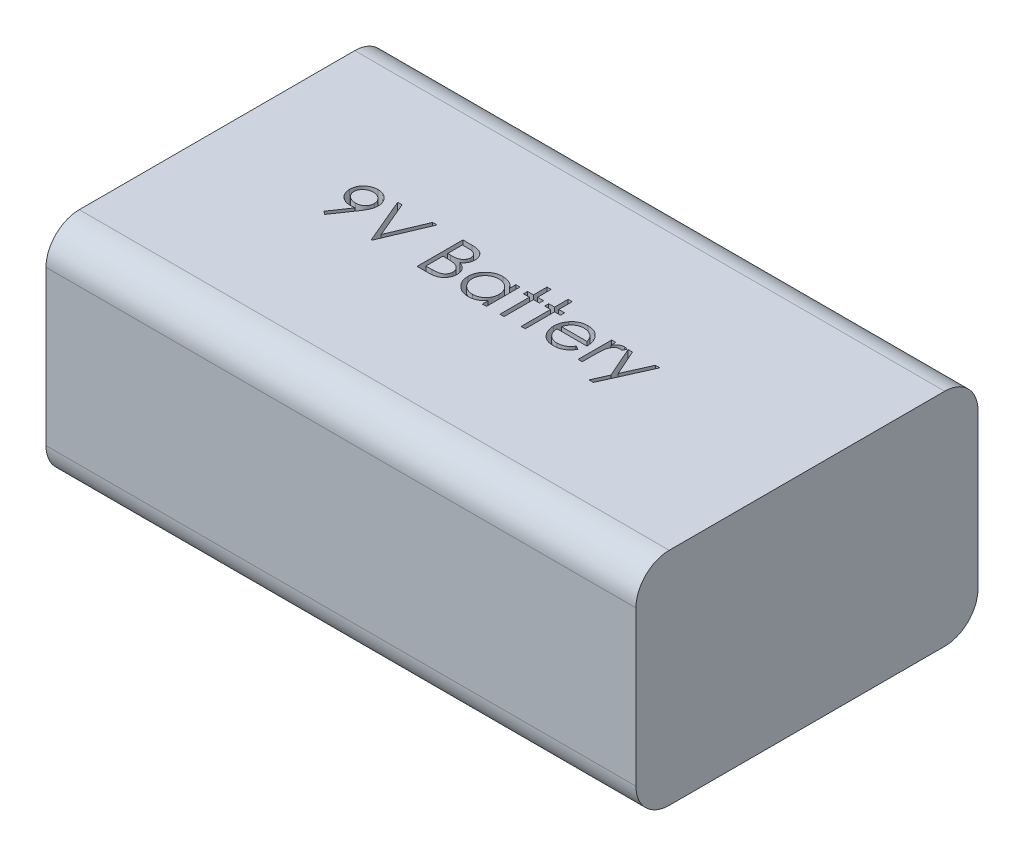
from build123d import *

# Parameters (mm, degrees)
SKETCH1_W           = 47.5742
SKETCH1_H           = 26.1112
BOSS_EXTRUDE1_DEPTH = 16.8656
CUT_EXTRUDE1_DEPTH  = 1.778
SKETCH3_W           = 26.1112
SKETCH3_H           = 16.8656
SKETCH3_R           = 3.81
CUT_EXTRUDE2_DEPTH  = 2.54
FILLET2_R           = 2.54


with BuildPart() as part:
    # Sketch1 → Boss-Extrude1 (new body)
    with BuildSketch(Plane(origin=(0, 0, 0), x_dir=(1, 0, 0), z_dir=(0, 1, 0))):
        with Locations((23.7871, 13.0556)):
            Rectangle(SKETCH1_W, SKETCH1_H)
    extrude(amount=BOSS_EXTRUDE1_DEPTH)

    # Sketch2 → Cut-Extrude1 (cut)
    # profile 1 of 9: a face of its own
    with BuildSketch(Plane(origin=(0, 16.8656, 0), x_dir=(1, 0, 0), z_dir=(0, 1, 0))):
        with BuildLine():
            Line((12.226093924, 11.595445946), (11.975092322, 11.770025272))
            Line((11.975092322, 11.770025272), (12.948249373, 13.192601394))
            add(Edge.make_bspline(
                [(12.948249373, 13.192601394), (12.886158637, 13.185008331), (12.763898517, 13.170057166), (12.640761415, 13.167310511), (12.58016043, 13.165958766)],
                knots=[0, 0, 0, 0, 1.015715272, 2, 2, 2, 2], degree=3))
            add(Edge.make_bspline(
                [(12.58016043, 13.165958766), (12.543418383, 13.166899843), (12.471296956, 13.168747093), (12.365265303, 13.183388902), (12.263379743, 13.205939029), (12.165910387, 13.239587784), (12.072490882, 13.281405993), (11.983325169, 13.333263007), (11.898533278, 13.394269299), (11.819025868, 13.46410229), (11.746714129, 13.540780343), (11.682290831, 13.621935986), (11.6287497, 13.708511956), (11.584273114, 13.798742176), (11.550542661, 13.893923527), (11.525980123, 13.992972927), (11.510857769, 14.096584569), (11.509058673, 14.1671097), (11.508145206, 14.202917901)],
                knots=[0, 0, 0, 0, 1.060718605, 2.082097864, 3.085795603, 4.069760067, 5.054557537, 6.03741023, 7.043284206, 8.066802108, 9.088538119, 10.083643548, 11.053783639, 12.022749082, 12.983451788, 13.964007469, 14.966251758, 16, 16, 16, 16], degree=3))
            add(Edge.make_bspline(
                [(11.508145206, 14.202917901), (11.509879641, 14.251886553), (11.513283985, 14.348002085), (11.540682502, 14.488435854), (11.585742841, 14.621222398), (11.648571218, 14.746012591), (11.727705939, 14.861011331), (11.822814529, 14.96461994), (11.933318494, 15.055364794), (12.056700513, 15.133368871), (12.190053534, 15.196103868), (12.329722192, 15.242343169), (12.474636312, 15.269541917), (12.572803982, 15.273127778), (12.622227738, 15.274933125)],
                knots=[0, 0, 0, 0, 1.022988612, 2.007919123, 2.978103895, 3.94594894, 4.918897164, 5.887013414, 6.875921846, 7.89917871, 8.930658928, 9.948724884, 10.967259574, 12, 12, 12, 12], degree=3))
            add(Edge.make_bspline(
                [(12.622227738, 15.274933125), (12.670716158, 15.273102962), (12.766524705, 15.269486732), (12.907413711, 15.243002763), (13.042354728, 15.19836609), (13.170599715, 15.136681527), (13.289339127, 15.059360619), (13.396114938, 14.967226095), (13.488490477, 14.860220568), (13.566314358, 14.740932078), (13.628784398, 14.612765097), (13.673856681, 14.478981174), (13.70160232, 14.340542453), (13.705098647, 14.246747979), (13.706863155, 14.199412292)],
                knots=[0, 0, 0, 0, 1.026385292, 2.028040595, 3.023318987, 4.028184125, 5.03290303, 6.015178782, 7.004435299, 8.016004309, 9.023023918, 10.015172535, 10.998308025, 12, 12, 12, 12], degree=3))
            add(Edge.make_bspline(
                [(13.706863155, 14.199412292), (13.705684746, 14.162668525), (13.703294638, 14.088142984), (13.686558331, 13.974912641), (13.658138146, 13.859461412), (13.625886447, 13.761739816), (13.594754279, 13.681031366), (13.565453148, 13.617279786), (13.532940994, 13.550178523), (13.495022229, 13.480431185), (13.454259932, 13.40714865), (13.408200656, 13.331065934), (13.357895084, 13.252080941), (13.322065364, 13.198833853), (13.303718123, 13.17156774)],
                knots=[0, 0, 0, 0, 1.179839688, 2.393009684, 3.667231171, 4.993948276, 5.694988576, 6.444077775, 7.246288328, 8.089075292, 8.993003841, 9.939041771, 10.944649915, 12, 12, 12, 12], degree=3))
            Line((13.303718123, 13.17156774), (12.226093924, 11.595445946))
        make_face()
        with BuildLine():
            add(Edge.make_bspline(
                [(12.638353539, 13.524933125), (12.666187554, 13.525693509), (12.720370917, 13.527173717), (12.799748216, 13.536182959), (12.874672419, 13.552156945), (12.945343668, 13.575076658), (13.01247057, 13.602733326), (13.074986899, 13.637945313), (13.132944974, 13.679961947), (13.186732901, 13.727171963), (13.234496901, 13.779622547), (13.277039931, 13.834519653), (13.313200499, 13.892104263), (13.341763776, 13.953097526), (13.365248351, 14.016014734), (13.381466363, 14.081869089), (13.390450697, 14.15031749), (13.391982271, 14.196816148), (13.392760591, 14.220445946)],
                knots=[0, 0, 0, 0, 1.163407946, 2.26475976, 3.333800367, 4.359385343, 5.366239384, 6.363380779, 7.350133999, 8.353570782, 9.349036268, 10.310270964, 11.253520213, 12.184142, 13.120487599, 14.056272588, 15.012232024, 16, 16, 16, 16], degree=3))
            add(Edge.make_bspline(
                [(13.392760591, 14.220445946), (13.392090922, 14.244085611), (13.390771256, 14.290670471), (13.380183957, 14.359220211), (13.361558733, 14.424913471), (13.336568249, 14.488109901), (13.303648011, 14.548290273), (13.264144525, 14.606210145), (13.217212075, 14.661502273), (13.163209509, 14.712866256), (13.104974956, 14.760214156), (13.042914456, 14.802000232), (12.97753954, 14.837021428), (12.90924905, 14.865920398), (12.837900701, 14.888472174), (12.763536713, 14.904689538), (12.685781308, 14.913661293), (12.633000021, 14.915183187), (12.606101937, 14.915958766)],
                knots=[0, 0, 0, 0, 0.972161553, 1.915763587, 2.844109794, 3.775983486, 4.705125789, 5.659731448, 6.655561913, 7.682237399, 8.721216875, 9.739758359, 10.754845918, 11.767244016, 12.7857855, 13.828538656, 14.893392813, 16, 16, 16, 16], degree=3))
            add(Edge.make_bspline(
                [(12.606101937, 14.915958766), (12.579437784, 14.915181934), (12.527122934, 14.913657797), (12.450058775, 14.904706592), (12.376197607, 14.888363108), (12.305055987, 14.865930844), (12.236767526, 14.837019272), (12.171395693, 14.801998397), (12.109320677, 14.760223774), (12.051141956, 14.712829002), (11.997044034, 14.661741356), (11.950918505, 14.605967927), (11.911324613, 14.548320402), (11.87844961, 14.488101894), (11.853447093, 14.424915609), (11.834825091, 14.359219632), (11.824236926, 14.290670622), (11.822917379, 14.244085662), (11.82224777, 14.220445946)],
                knots=[0, 0, 0, 0, 1.099389452, 2.15699305, 3.192601482, 4.213358962, 5.227959689, 6.245255729, 7.266013209, 8.307253147, 9.336162325, 10.327954924, 11.284637477, 12.215801273, 13.149702402, 14.080068371, 15.025723358, 16, 16, 16, 16], degree=3))
            add(Edge.make_bspline(
                [(11.82224777, 14.220445946), (11.822853696, 14.196797747), (11.824048694, 14.150159171), (11.835576483, 14.081632778), (11.854854763, 14.015944584), (11.880674154, 13.952455877), (11.914675744, 13.891784019), (11.956399592, 13.834216657), (12.005305138, 13.779101207), (12.060738626, 13.727293995), (12.121406786, 13.679741819), (12.186203533, 13.638211437), (12.254013369, 13.603138993), (12.325075, 13.574997609), (12.3988618, 13.552385945), (12.476036932, 13.5362124), (12.556345169, 13.527260133), (12.610755151, 13.525716236), (12.638353539, 13.524933125)],
                knots=[0, 0, 0, 0, 0.952633368, 1.87876736, 2.791047057, 3.707742249, 4.635551637, 5.587206343, 6.568248508, 7.601284464, 8.641511608, 9.671105535, 10.699146789, 11.713763218, 12.747829548, 13.806491675, 14.887386225, 16, 16, 16, 16], degree=3))
        make_face(mode=Mode.SUBTRACT)
    # profile 2 of 9: a face of its own
    with BuildSketch(Plane(origin=(0, 16.8656, 0), x_dir=(1, 0, 0), z_dir=(0, 1, 0))):
        Polygon((14.200452898, 15.185189535), (14.53699136, 15.185189535), (15.703658027, 12.426976394), (16.870324693, 15.185189535), (17.206863155, 15.185189535), (15.726093924, 11.685189535), (15.681222129, 11.685189535), align=None)
    # profile 3 of 9: a face of its own
    with BuildSketch(Plane(origin=(0, 16.8656, 0), x_dir=(1, 0, 0), z_dir=(0, 1, 0))):
        with BuildLine():
            Line((19.181222129, 15.185189535), (19.864114757, 15.185189535))
            add(Edge.make_bspline(
                [(19.864114757, 15.185189535), (19.897543236, 15.185013785), (19.962335946, 15.184673137), (20.056555388, 15.179390006), (20.144804198, 15.172186336), (20.227107971, 15.160756243), (20.303428673, 15.146964466), (20.37399631, 15.13026265), (20.438586483, 15.110236036), (20.515699219, 15.078389755), (20.60361988, 15.031066587), (20.698818273, 14.961138022), (20.780222512, 14.875605558), (20.850408829, 14.779122903), (20.906209949, 14.672987131), (20.946579246, 14.559727942), (20.972137122, 14.440806201), (20.974765556, 14.359163023), (20.976093924, 14.317901875)],
                knots=[0, 0, 0, 0, 1.001505555, 1.941167018, 2.826882275, 3.653841531, 4.429895133, 5.150066043, 5.825578002, 6.45369114, 7.647487171, 8.808567382, 9.977351308, 11.170798116, 12.373658725, 13.556498008, 14.765093433, 16, 16, 16, 16], degree=3))
            add(Edge.make_bspline(
                [(20.976093924, 14.317901875), (20.975000706, 14.279249319), (20.972852428, 14.203293402), (20.952309669, 14.092199293), (20.920149001, 13.986448074), (20.875443751, 13.886425689), (20.817341755, 13.794392076), (20.748483437, 13.70960481), (20.665406634, 13.635653753), (20.603163394, 13.59431085), (20.571546648, 13.573310529)],
                knots=[0, 0, 0, 0, 1.044552857, 2.05264487, 3.044412934, 4.028983338, 5.005914585, 5.980388656, 6.974128949, 8, 8, 8, 8], degree=3))
            add(Edge.make_bspline(
                [(20.571546648, 13.573310529), (20.611307076, 13.55804553), (20.687378623, 13.528839806), (20.792064636, 13.477204342), (20.882259481, 13.421042231), (20.958656627, 13.359710381), (21.023994282, 13.29360157), (21.081047223, 13.221746456), (21.129728597, 13.143207698), (21.171441521, 13.058804163), (21.203990277, 12.969397694), (21.228366181, 12.875826918), (21.242333631, 12.778427363), (21.244321272, 12.712141984), (21.245324693, 12.678679119)],
                knots=[0, 0, 0, 0, 1.27268992, 2.434971085, 3.483601985, 4.442670788, 5.356604649, 6.2567628, 7.179492994, 8.113709626, 9.066344395, 10.018646069, 10.999752585, 12, 12, 12, 12], degree=3))
            add(Edge.make_bspline(
                [(21.245324693, 12.678679119), (21.244347847, 12.644512246), (21.242425875, 12.577287968), (21.228245904, 12.478532834), (21.204236797, 12.384157887), (21.17116565, 12.293552705), (21.128003336, 12.20689257), (21.075475371, 12.124079306), (21.012843808, 12.045944975), (20.942780939, 11.971621352), (20.863518793, 11.904793565), (20.778003038, 11.845277858), (20.685156718, 11.796331796), (20.586504724, 11.755215775), (20.480940408, 11.723808576), (20.368937801, 11.701836002), (20.250593499, 11.687030965), (20.169383748, 11.68581376), (20.127736552, 11.685189535)],
                knots=[0, 0, 0, 0, 0.978564426, 1.925352924, 2.850884081, 3.763762016, 4.682927383, 5.618979971, 6.567305752, 7.547517671, 8.540179244, 9.531824382, 10.526200242, 11.540722885, 12.589160233, 13.674978461, 14.80764778, 16, 16, 16, 16], degree=3))
            Line((20.127736552, 11.685189535), (19.181222129, 11.685189535))
            Line((19.181222129, 11.685189535), (19.181222129, 15.185189535))
        make_face()
        with BuildLine():
            Line((19.495324693, 14.826215176), (19.495324693, 13.704420305))
            Line((19.495324693, 13.704420305), (19.706362354, 13.704420305))
            add(Edge.make_bspline(
                [(19.706362354, 13.704420305), (19.737211149, 13.704820228), (19.796817308, 13.70559296), (19.883137205, 13.707806477), (19.963262223, 13.714004521), (20.037054056, 13.720200783), (20.1043965, 13.73027537), (20.165140361, 13.742267493), (20.220238958, 13.754950398), (20.283778504, 13.776519885), (20.355851452, 13.808397561), (20.432684557, 13.857869397), (20.500419026, 13.91679375), (20.557616214, 13.984784712), (20.604427684, 14.059650897), (20.6369414, 14.140197778), (20.658988684, 14.22441791), (20.660980215, 14.282236163), (20.66199136, 14.311591779)],
                knots=[0, 0, 0, 0, 1.156816544, 2.235205308, 3.236616184, 4.169592532, 5.011045266, 5.787822928, 6.49130361, 7.128639758, 8.301311294, 9.436451833, 10.541879658, 11.654887649, 12.756523258, 13.837046038, 14.901820046, 16, 16, 16, 16], degree=3))
            add(Edge.make_bspline(
                [(20.66199136, 14.311591779), (20.66146518, 14.33101755), (20.66043302, 14.369123322), (20.651979717, 14.424672677), (20.637612143, 14.476916429), (20.61915785, 14.526570539), (20.593369161, 14.57208239), (20.563005698, 14.615025585), (20.526320007, 14.653937704), (20.484562695, 14.690307202), (20.436554072, 14.72255173), (20.38232278, 14.750792493), (20.321135103, 14.77353327), (20.254022248, 14.793449422), (20.17995116, 14.807437716), (20.099776607, 14.819091104), (20.012841888, 14.825023846), (19.952696785, 14.825809209), (19.921606745, 14.826215176)],
                knots=[0, 0, 0, 0, 0.91205012, 1.789085906, 2.630437955, 3.453916878, 4.269457761, 5.079663411, 5.91843418, 6.774407191, 7.675494373, 8.627863946, 9.638891023, 10.736472738, 11.911756761, 13.175263542, 14.539845004, 16, 16, 16, 16], degree=3))
            Line((19.921606745, 14.826215176), (19.495324693, 14.826215176))
        make_face(mode=Mode.SUBTRACT)
        with BuildLine():
            Line((19.495324693, 13.345445946), (19.495324693, 12.044163894))
            Line((19.495324693, 12.044163894), (19.942640398, 12.044163894))
            add(Edge.make_bspline(
                [(19.942640398, 12.044163894), (19.974659324, 12.044547642), (20.036371583, 12.045287264), (20.125472813, 12.047701819), (20.208055917, 12.053194094), (20.283744053, 12.061839944), (20.353354505, 12.071218393), (20.416052208, 12.083829674), (20.472345402, 12.098278635), (20.537619709, 12.120612807), (20.611123218, 12.155309278), (20.690334074, 12.207623504), (20.760760292, 12.269946812), (20.820565551, 12.342077726), (20.86957854, 12.420509053), (20.905233995, 12.503654403), (20.927224852, 12.590139931), (20.929887021, 12.649106643), (20.931222129, 12.678679119)],
                knots=[0, 0, 0, 0, 1.160039823, 2.235823828, 3.228722157, 4.157150951, 4.99529583, 5.772374946, 6.472645482, 7.099169577, 8.269452708, 9.405989375, 10.527446681, 11.663510218, 12.788923519, 13.866172445, 14.929861265, 16, 16, 16, 16], degree=3))
            add(Edge.make_bspline(
                [(20.931222129, 12.678679119), (20.930946025, 12.697172459), (20.93039827, 12.733860841), (20.922137655, 12.78777666), (20.910123785, 12.840002533), (20.894592351, 12.890680274), (20.871972884, 12.93889365), (20.845566339, 12.98559621), (20.814604937, 13.030849689), (20.766360772, 13.088061943), (20.696188787, 13.153978956), (20.596482012, 13.218516458), (20.483109714, 13.270564265), (20.400882221, 13.292663741), (20.358405623, 13.30407976)],
                knots=[0, 0, 0, 0, 0.723448775, 1.435228256, 2.130040452, 2.821711965, 3.505591119, 4.210454504, 4.921174351, 5.648778258, 7.137944449, 8.670945889, 10.280296675, 12, 12, 12, 12], degree=3))
            add(Edge.make_bspline(
                [(20.358405623, 13.30407976), (20.341376527, 13.307534844), (20.304453935, 13.315026178), (20.244246354, 13.322933882), (20.175510485, 13.329978942), (20.098087608, 13.335190099), (20.011879767, 13.340576643), (19.916702848, 13.342671464), (19.812945534, 13.345170724), (19.740953161, 13.345351858), (19.703557866, 13.345445946)],
                knots=[0, 0, 0, 0, 0.634451884, 1.375622551, 2.216452059, 3.157844607, 4.20941857, 5.370758133, 6.634282058, 8, 8, 8, 8], degree=3))
            Line((19.703557866, 13.345445946), (19.495324693, 13.345445946))
        make_face(mode=Mode.SUBTRACT)
    # profile 4 of 9: a face of its own
    with BuildSketch(Plane(origin=(0, 16.8656, 0), x_dir=(1, 0, 0), z_dir=(0, 1, 0))):
        with BuildLine():
            Line((24.476093924, 14.242881843), (24.476093924, 11.685189535))
            Line((24.476093924, 11.685189535), (24.16199136, 11.685189535))
            Line((24.16199136, 11.685189535), (24.16199136, 12.127597388))
            add(Edge.make_bspline(
                [(24.16199136, 12.127597388), (24.126572569, 12.087557794), (24.057452354, 12.009420023), (23.942011236, 11.90733785), (23.819643058, 11.822959529), (23.690941737, 11.754809613), (23.556023494, 11.703617557), (23.415187406, 11.667231398), (23.268376026, 11.643837562), (23.168123671, 11.641501541), (23.117319886, 11.64031774)],
                knots=[0, 0, 0, 0, 1.074387032, 2.096679803, 3.090159297, 4.057316773, 5.018401886, 5.985159533, 6.978961417, 8, 8, 8, 8], degree=3))
            add(Edge.make_bspline(
                [(23.117319886, 11.64031774), (23.072151932, 11.641544113), (22.983078727, 11.643962573), (22.85204965, 11.662724877), (22.7259574, 11.692855498), (22.604682828, 11.734756388), (22.489010682, 11.790337209), (22.377950586, 11.856878458), (22.272077894, 11.936119288), (22.173006355, 12.026707316), (22.081774354, 12.125102303), (22.001713082, 12.23004785), (21.934960002, 12.341090154), (21.879139921, 12.456823308), (21.836143577, 12.578138227), (21.806169942, 12.704615395), (21.787429496, 12.836105269), (21.785012035, 12.925644792), (21.783786232, 12.971046907)],
                knots=[0, 0, 0, 0, 1.033919861, 2.038935746, 3.024066025, 3.998881131, 4.97069526, 5.957263378, 6.95902576, 7.993208707, 9.027059324, 10.027763471, 11.009749337, 11.988697705, 12.965288445, 13.950418724, 14.960734635, 16, 16, 16, 16], degree=3))
            add(Edge.make_bspline(
                [(21.783786232, 12.971046907), (21.785039203, 13.015510611), (21.78751626, 13.103412954), (21.80596948, 13.232691652), (21.837000488, 13.357209913), (21.880548336, 13.476566856), (21.936390291, 13.590906906), (22.004318378, 13.700310931), (22.084337503, 13.805080329), (22.17658991, 13.902751555), (22.27652468, 13.99297217), (22.383433411, 14.071381215), (22.494656692, 14.139098064), (22.611919703, 14.19275154), (22.733486808, 14.236160645), (22.860440253, 14.266193613), (22.992251832, 14.283890934), (23.081742324, 14.286453698), (23.127135591, 14.287753638)],
                knots=[0, 0, 0, 0, 1.020392517, 2.01726096, 2.990465484, 3.961182959, 4.928053699, 5.906110375, 6.912531644, 7.948652711, 8.985773172, 9.998621852, 10.987621588, 11.969261332, 12.953316658, 13.946091881, 14.958173133, 16, 16, 16, 16], degree=3))
            add(Edge.make_bspline(
                [(23.127135591, 14.287753638), (23.17933545, 14.286315886), (23.28169691, 14.283496523), (23.431424919, 14.260033796), (23.573069397, 14.220395329), (23.707723749, 14.166477831), (23.834904435, 14.094829102), (23.953407419, 14.004449141), (24.064472903, 13.895907954), (24.128853194, 13.812537509), (24.16199136, 13.769624631)],
                knots=[0, 0, 0, 0, 1.038897134, 2.037228247, 3.008116434, 3.962042015, 4.918381754, 5.904844433, 6.921570401, 8, 8, 8, 8], degree=3))
            Line((24.16199136, 13.769624631), (24.16199136, 14.242881843))
            Line((24.16199136, 14.242881843), (24.476093924, 14.242881843))
        make_face()
        with BuildLine():
            add(Edge.make_bspline(
                [(23.131342322, 13.973651074), (23.085427984, 13.972017436), (22.994800384, 13.968792895), (22.861756382, 13.9436194), (22.734442968, 13.901734805), (22.613496893, 13.844452904), (22.500828677, 13.772424168), (22.400135006, 13.685302784), (22.310592304, 13.58546577), (22.23528404, 13.47336366), (22.173893543, 13.353185569), (22.130726511, 13.227561131), (22.102257264, 13.098756153), (22.099348743, 13.011393467), (22.097888796, 12.967541298)],
                knots=[0, 0, 0, 0, 1.031046209, 2.035121221, 3.029706178, 4.034933723, 5.034054252, 6.02443088, 7.017295772, 8.038157696, 9.050218397, 10.03989886, 11.016116709, 12, 12, 12, 12], degree=3))
            add(Edge.make_bspline(
                [(22.097888796, 12.967541298), (22.099753689, 12.923951191), (22.103476166, 12.836941835), (22.13022686, 12.707961258), (22.175106734, 12.582307216), (22.236348797, 12.461046223), (22.313035421, 12.348462122), (22.401924074, 12.246722), (22.503874355, 12.159232412), (22.616801862, 12.085994838), (22.737409833, 12.026832317), (22.864243764, 11.985666677), (22.994919402, 11.959088897), (23.083771736, 11.95598442), (23.128537834, 11.954420305)],
                knots=[0, 0, 0, 0, 0.979072187, 1.954306742, 2.945804271, 3.96968567, 4.997920485, 5.998718438, 6.996577872, 8.005894225, 9.015743152, 10.005417472, 10.995077863, 12, 12, 12, 12], degree=3))
            add(Edge.make_bspline(
                [(23.128537834, 11.954420305), (23.173984337, 11.956080268), (23.264372924, 11.959381772), (23.397811632, 11.984663037), (23.527306594, 12.026431836), (23.651093823, 12.084330962), (23.766409954, 12.156088318), (23.869907831, 12.240095409), (23.9574238, 12.337798593), (24.031616409, 12.445175047), (24.089791826, 12.562887043), (24.132167885, 12.688221234), (24.157221791, 12.821181982), (24.160379521, 12.912045909), (24.16199136, 12.958426715)],
                knots=[0, 0, 0, 0, 1.01762866, 2.023962475, 3.030623092, 4.058876274, 5.077231937, 6.066672613, 7.034107872, 8.005628644, 8.981990164, 9.965428785, 10.961468474, 12, 12, 12, 12], degree=3))
            add(Edge.make_bspline(
                [(24.16199136, 12.958426715), (24.161031704, 12.993764545), (24.159142796, 13.063320579), (24.144712227, 13.165448096), (24.1217573, 13.263181822), (24.08941113, 13.356624511), (24.046919846, 13.445259527), (23.99567208, 13.529723287), (23.93476663, 13.609576498), (23.865183934, 13.683719569), (23.789018732, 13.751346032), (23.708424191, 13.811710272), (23.622445444, 13.861299045), (23.532528407, 13.902340316), (23.438517073, 13.934999466), (23.339646453, 13.95678716), (23.236967466, 13.971747481), (23.16692141, 13.973009862), (23.131342322, 13.973651074)],
                knots=[0, 0, 0, 0, 1.050140795, 2.067009409, 3.05949893, 4.030605086, 5.00011959, 5.97591094, 6.962425594, 7.979863591, 8.993523472, 9.986985069, 10.967611495, 11.937549037, 12.921786183, 13.919465291, 14.943216303, 16, 16, 16, 16], degree=3))
        make_face(mode=Mode.SUBTRACT)
    # profile 5 of 9: a face of its own
    with BuildSketch(Plane(origin=(0, 16.8656, 0), x_dir=(1, 0, 0), z_dir=(0, 1, 0))):
        Polygon((25.508145206, 15.274933125), (25.82224777, 15.274933125), (25.82224777, 14.242881843), (26.270965719, 14.242881843), (26.270965719, 13.928779279), (25.82224777, 13.928779279), (25.82224777, 11.685189535), (25.508145206, 11.685189535), (25.508145206, 13.928779279), (25.059427257, 13.928779279), (25.059427257, 14.242881843), (25.508145206, 14.242881843), align=None)
    # profile 6 of 9: a face of its own
    with BuildSketch(Plane(origin=(0, 16.8656, 0), x_dir=(1, 0, 0), z_dir=(0, 1, 0))):
        Polygon((27.123529822, 15.274933125), (27.437632386, 15.274933125), (27.437632386, 14.242881843), (27.886350334, 14.242881843), (27.886350334, 13.928779279), (27.437632386, 13.928779279), (27.437632386, 11.685189535), (27.123529822, 11.685189535), (27.123529822, 13.928779279), (26.674811873, 13.928779279), (26.674811873, 14.242881843), (27.123529822, 14.242881843), align=None)
    # profile 7 of 9: a face of its own
    with BuildSketch(Plane(origin=(0, 16.8656, 0), x_dir=(1, 0, 0), z_dir=(0, 1, 0))):
        with BuildLine():
            Line((30.523970527, 12.492881843), (30.803017001, 12.346347388))
            add(Edge.make_bspline(
                [(30.803017001, 12.346347388), (30.780780406, 12.306904057), (30.737516797, 12.230162954), (30.663116049, 12.124731093), (30.585123977, 12.029883377), (30.500020009, 11.948153723), (30.41035033, 11.876902338), (30.315617675, 11.814564513), (30.215328857, 11.761445993), (30.109479133, 11.716693465), (29.997179581, 11.682283971), (29.878158065, 11.65797975), (29.75218657, 11.642956482), (29.66584039, 11.641211341), (29.621626777, 11.64031774)],
                knots=[0, 0, 0, 0, 1.120438281, 2.179929193, 3.190490725, 4.156257408, 5.095198341, 6.022838206, 6.959905092, 7.901321166, 8.864066838, 9.862729781, 10.905609505, 12, 12, 12, 12], degree=3))
            add(Edge.make_bspline(
                [(29.621626777, 11.64031774), (29.572484799, 11.641464916), (29.476623037, 11.643702722), (29.33708329, 11.662995187), (29.205703872, 11.694467546), (29.082492169, 11.738433087), (28.967749916, 11.795860411), (28.861249061, 11.865819893), (28.762429535, 11.947952148), (28.674405326, 12.042968591), (28.595161443, 12.144650548), (28.525235623, 12.250606433), (28.466778192, 12.360569657), (28.419225582, 12.473840181), (28.380820717, 12.589704075), (28.354054013, 12.709215543), (28.338624265, 12.832051127), (28.33625982, 12.915148463), (28.335068283, 12.957024471)],
                knots=[0, 0, 0, 0, 1.145258523, 2.234067595, 3.276747158, 4.290159414, 5.277019952, 6.260822364, 7.254936242, 8.264827045, 9.274100331, 10.257902744, 11.220704747, 12.172965371, 13.118907548, 14.062713208, 15.023725156, 16, 16, 16, 16], degree=3))
            add(Edge.make_bspline(
                [(28.335068283, 12.957024471), (28.336127424, 12.996319302), (28.338226503, 13.074196466), (28.35145729, 13.189462011), (28.374905583, 13.301490463), (28.407081907, 13.410374911), (28.448633153, 13.515933045), (28.499465372, 13.618229109), (28.55965775, 13.717154249), (28.606130424, 13.779557382), (28.629539437, 13.810990817)],
                knots=[0, 0, 0, 0, 1.024358464, 2.0301432, 3.019427413, 4.004406732, 4.986367066, 5.972626655, 6.978780325, 8, 8, 8, 8], degree=3))
            add(Edge.make_bspline(
                [(28.629539437, 13.810990817), (28.66124712, 13.848859687), (28.723658066, 13.923397838), (28.829214422, 14.021336164), (28.943514618, 14.103379939), (29.065126244, 14.171387075), (29.195462718, 14.223060722), (29.332772009, 14.261568304), (29.478617595, 14.283146315), (29.578322816, 14.286194149), (29.629339116, 14.287753638)],
                knots=[0, 0, 0, 0, 1.030682036, 2.02871468, 2.997146059, 3.962720338, 4.930598197, 5.918074684, 6.934738563, 8, 8, 8, 8], degree=3))
            add(Edge.make_bspline(
                [(29.629339116, 14.287753638), (29.681786722, 14.286399589), (29.784676968, 14.283743254), (29.934709089, 14.25911692), (30.076669805, 14.220064366), (30.21050231, 14.164910575), (30.33622017, 14.093751023), (30.45300622, 14.005609182), (30.562857732, 13.903191095), (30.626766311, 13.824427885), (30.659287033, 13.784348189)],
                knots=[0, 0, 0, 0, 1.056321875, 2.072262726, 3.055038591, 4.01806755, 4.982017516, 5.957941055, 6.960871419, 8, 8, 8, 8], degree=3))
            add(Edge.make_bspline(
                [(30.659287033, 13.784348189), (30.681413971, 13.754144608), (30.725520564, 13.693938489), (30.780767665, 13.595767332), (30.828725059, 13.493056738), (30.867058021, 13.384146441), (30.898097522, 13.27032686), (30.92055434, 13.150784316), (30.933723959, 13.025554404), (30.936312656, 12.940227849), (30.937632386, 12.896727997)],
                knots=[0, 0, 0, 0, 0.94817472, 1.890038105, 2.849395472, 3.817997239, 4.812318967, 5.836947057, 6.897266129, 8, 8, 8, 8], degree=3))
            Line((30.937632386, 12.896727997), (28.649170847, 12.896727997))
            add(Edge.make_bspline(
                [(28.649170847, 12.896727997), (28.650710454, 12.863027533), (28.653738028, 12.796756929), (28.667853171, 12.699786146), (28.690101944, 12.607412804), (28.721371007, 12.520329762), (28.759237852, 12.437399634), (28.805623569, 12.359237597), (28.860963123, 12.286199667), (28.922688822, 12.217632529), (28.991395918, 12.156571768), (29.063678665, 12.101919992), (29.14057223, 12.056114395), (29.221470314, 12.018934506), (29.306242099, 11.98982819), (29.394914294, 11.969960369), (29.48731241, 11.956653262), (29.550298144, 11.955173597), (29.582363956, 11.954420305)],
                knots=[0, 0, 0, 0, 1.094153842, 2.151609401, 3.174256925, 4.172055639, 5.149267565, 6.128595816, 7.11444997, 8.118368179, 9.117203808, 10.09244225, 11.054858984, 12.015122123, 12.976791628, 13.957293641, 14.960065497, 16, 16, 16, 16], degree=3))
            add(Edge.make_bspline(
                [(29.582363956, 11.954420305), (29.613715104, 11.955028361), (29.675921795, 11.956234862), (29.768562652, 11.967966773), (29.859702179, 11.986937049), (29.948963163, 12.012827039), (30.034534009, 12.044403891), (30.113779559, 12.082506749), (30.186659774, 12.124656495), (30.254776741, 12.17286617), (30.320847734, 12.231874357), (30.386390221, 12.305510078), (30.456666874, 12.392597606), (30.500656467, 12.458143272), (30.523970527, 12.492881843)],
                knots=[0, 0, 0, 0, 0.99110716, 1.966546729, 2.947904876, 3.932708344, 4.903319531, 5.828989031, 6.710028674, 7.56322171, 8.463672341, 9.504779593, 10.677557249, 12, 12, 12, 12], degree=3))
        make_face()
        with BuildLine():
            add(Edge.make_bspline(
                [(30.623529822, 13.210830561), (30.612033197, 13.252493435), (30.589905895, 13.332681055), (30.543669531, 13.443721946), (30.49159799, 13.542409847), (30.429976259, 13.62798948), (30.360157533, 13.703992993), (30.279512351, 13.770411578), (30.189076457, 13.829829029), (30.089317317, 13.879981528), (29.983675531, 13.922671387), (29.873069339, 13.951296503), (29.760211552, 13.970906045), (29.683877265, 13.972732154), (29.645464918, 13.973651074)],
                knots=[0, 0, 0, 0, 1.154881502, 2.222775134, 3.210006277, 4.132804581, 5.035138423, 5.962687519, 6.919655026, 7.923214229, 8.944639381, 9.960483929, 10.97369054, 12, 12, 12, 12], degree=3))
            add(Edge.make_bspline(
                [(29.645464918, 13.973651074), (29.614115479, 13.973039402), (29.55214423, 13.971830256), (29.460843162, 13.960360127), (29.373163463, 13.941400282), (29.288458175, 13.915435325), (29.207837307, 13.880826723), (29.129642539, 13.840243496), (29.055862143, 13.790701912), (29.009720847, 13.752943058), (28.98641043, 13.73386742)],
                knots=[0, 0, 0, 0, 1.04873581, 2.073130211, 3.073294108, 4.04793562, 5.032784715, 6.005352987, 6.992311501, 8, 8, 8, 8], degree=3))
            add(Edge.make_bspline(
                [(28.98641043, 13.73386742), (28.969717149, 13.718773104), (28.935934014, 13.688225888), (28.890793493, 13.635596682), (28.84757302, 13.57884512), (28.808239367, 13.515799995), (28.772161781, 13.447179216), (28.738401804, 13.373561581), (28.708015392, 13.29438845), (28.690919282, 13.239216011), (28.682123572, 13.210830561)],
                knots=[0, 0, 0, 0, 0.879870761, 1.780643979, 2.707998968, 3.669668524, 4.684282772, 5.740141944, 6.837334558, 8, 8, 8, 8], degree=3))
            Line((28.682123572, 13.210830561), (30.623529822, 13.210830561))
        make_face(mode=Mode.SUBTRACT)
    # profile 8 of 9: a face of its own
    with BuildSketch(Plane(origin=(0, 16.8656, 0), x_dir=(1, 0, 0), z_dir=(0, 1, 0))):
        with BuildLine():
            Line((31.476093924, 14.242881843), (31.790196488, 14.242881843))
            Line((31.790196488, 14.242881843), (31.790196488, 13.866379439))
            add(Edge.make_bspline(
                [(31.790196488, 13.866379439), (31.813385247, 13.901435267), (31.857733568, 13.968479267), (31.931446497, 14.057148568), (32.006949829, 14.130563614), (32.084605016, 14.189067133), (32.164983116, 14.232880252), (32.246320067, 14.264973287), (32.329895537, 14.283950602), (32.386057462, 14.286484261), (32.414194886, 14.287753638)],
                knots=[0, 0, 0, 0, 1.2804753, 2.448899062, 3.506932113, 4.484331642, 5.4025378, 6.288909075, 7.142734305, 8, 8, 8, 8], degree=3))
            add(Edge.make_bspline(
                [(32.414194886, 14.287753638), (32.436021212, 14.286563111), (32.480930297, 14.284113525), (32.548912887, 14.266902701), (32.618956339, 14.239424678), (32.664098726, 14.213584456), (32.687632386, 14.200113413)],
                knots=[0, 0, 0, 0, 0.901110191, 1.854092781, 2.881294221, 4, 4, 4, 4], degree=3))
            Line((32.687632386, 14.200113413), (32.515156424, 13.928078157))
            add(Edge.make_bspline(
                [(32.515156424, 13.928078157), (32.500047403, 13.934818423), (32.471367588, 13.947612739), (32.429413022, 13.962754749), (32.390731685, 13.971670665), (32.366088127, 13.973021382), (32.354599533, 13.973651074)],
                knots=[0, 0, 0, 0, 1.180555205, 2.24091978, 3.179933427, 4, 4, 4, 4], degree=3))
            add(Edge.make_bspline(
                [(32.354599533, 13.973651074), (32.3293938, 13.971971036), (32.27798141, 13.968544247), (32.20249691, 13.941605439), (32.129249705, 13.898080199), (32.071078042, 13.849809087), (32.026035789, 13.80326129), (31.993895564, 13.762612887), (31.964412817, 13.717034256), (31.936242597, 13.667304572), (31.910576302, 13.612574726), (31.886621633, 13.553391513), (31.86496277, 13.489686384), (31.852612526, 13.445303864), (31.846286232, 13.422569343)],
                knots=[0, 0, 0, 0, 1.125678352, 2.296057538, 3.5422874, 4.923748041, 5.663163013, 6.437101912, 7.23742474, 8.08941207, 8.991984279, 9.93940061, 10.944477711, 12, 12, 12, 12], degree=3))
            add(Edge.make_bspline(
                [(31.846286232, 13.422569343), (31.841553838, 13.402292169), (31.831071947, 13.357379771), (31.820880409, 13.282031246), (31.810810891, 13.193007587), (31.803714273, 13.090060994), (31.79713623, 12.97344855), (31.793426148, 12.842992605), (31.790323008, 12.698559254), (31.790239941, 12.5975849), (31.790196488, 12.544764856)],
                knots=[0, 0, 0, 0, 0.566838948, 1.255505196, 2.06880316, 3.007127437, 4.065329342, 5.249902469, 6.561414163, 8, 8, 8, 8], degree=3))
            Line((31.790196488, 12.544764856), (31.790196488, 11.685189535))
            Line((31.790196488, 11.685189535), (31.476093924, 11.685189535))
            Line((31.476093924, 11.685189535), (31.476093924, 14.242881843))
        make_face()
    # profile 9 of 9: a face of its own
    with BuildSketch(Plane(origin=(0, 16.8656, 0), x_dir=(1, 0, 0), z_dir=(0, 1, 0))):
        Polygon((32.73250418, 14.242881843), (33.071146007, 14.242881843), (33.937031424, 12.283947548), (34.816238155, 14.242881843), (35.155581104, 14.242881843), (33.585068283, 10.742881843), (33.245725334, 10.742881843), (33.766658828, 11.903238413), align=None)
    extrude(amount=-CUT_EXTRUDE1_DEPTH, mode=Mode.SUBTRACT)

    # Sketch3 → Cut-Extrude2 (cut)
    with BuildSketch(Plane.ZY):
        with Locations((-13.0556, 8.4328)):
            Rectangle(SKETCH3_W, SKETCH3_H)
        with Locations((-19.5834, 8.4328)):
            Circle(SKETCH3_R, mode=Mode.SUBTRACT)
        with Locations((-6.5278, 8.4328)):
            Circle(SKETCH3_R, mode=Mode.SUBTRACT)
    extrude(amount=-CUT_EXTRUDE2_DEPTH, mode=Mode.SUBTRACT)

    # Fillet2
    fillet2_edges = [part.edges().sort_by_distance(p)[0] for p in [
        (25.0571, 0, -26.1112),
        (25.0571, 0, 0),
        (25.0571, 16.8656, 0),
        (25.0571, 16.8656, -26.1112),
    ]]
    fillet(fillet2_edges, radius=FILLET2_R)


solid = part.part
